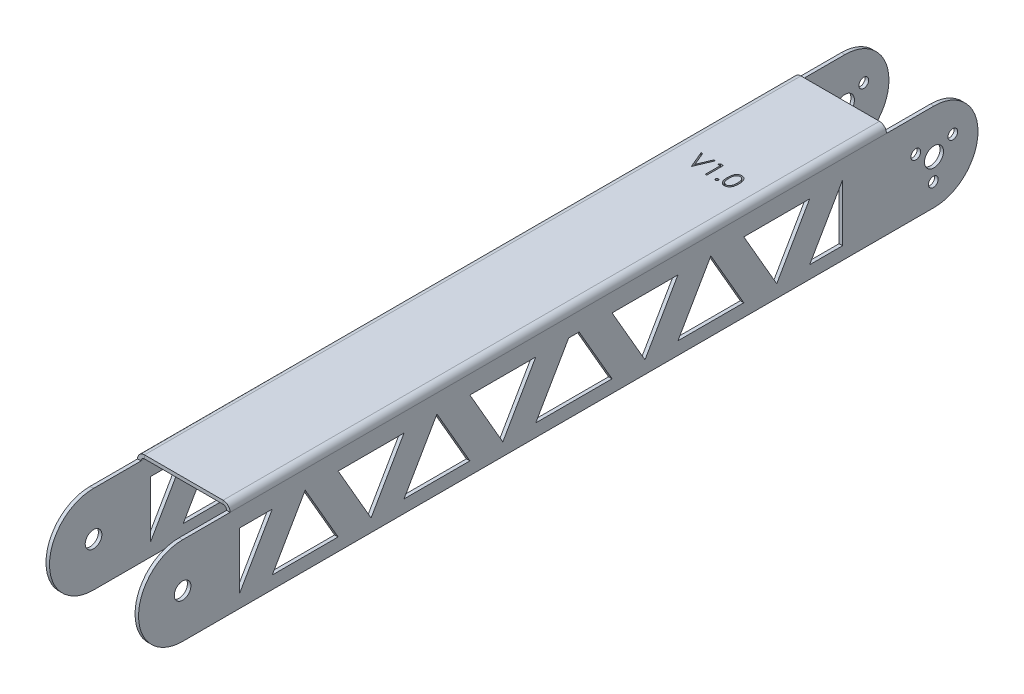
from build123d import *

# Parameters (mm, degrees)
SKETCH1_W                    = 16
SKETCH1_H                    = 138.1
BASE_FLANGE1_DEPTH           = 0.7366
EDGE_FLANGE1_DEPTH           = 138.1
EDGE_FLANGE1_BEND_DEPTH      = 138.1
SKETCH12_R                   = 2
TAB1_DEPTH                   = 0.7366
SKETCH15_R                   = 1.75
TAB2_DEPTH                   = 0.7366
F_2_05_2_05_DIAMETER_HOLE1_D = 2.05
CUT_EXTRUDE2_DEPTH           = 93.619987788
CUT_EXTRUDE3_DEPTH           = 10


# Sheet-metal steps are written as plain solids
with BuildPart() as part:
    # Sketch1 → Base-Flange1 (new body)
    with BuildSketch(Plane(origin=(0, 0, 0), x_dir=(1, 0, 0), z_dir=(0, 1, 0))):
        Rectangle(SKETCH1_W, SKETCH1_H)
    extrude(amount=-BASE_FLANGE1_DEPTH)

    # Edge-Flange1 section (across the edge) → Edge-Flange1 (add)
    with BuildSketch(Plane(origin=(9, -0.7366, -69.05), x_dir=(-1, 0, 0), z_dir=(0, 0, 1))):
        with BuildLine():
            Line((-0.7366, 0.7366), (-0.7366, 19.2634))
            Line((-0.7366, 19.2634), (0, 19.2634))
            Line((0, 19.2634), (0, 0.7366))
            ThreePointArc((0, 0.7366), (0.215745145, 0.215745145), (0.7366, 0))
            Line((0.7366, 0), (1, 0))
            Line((1, 0), (1, -0.7366))
            Line((1, -0.7366), (0.7366, -0.7366))
            ThreePointArc((0.7366, -0.7366), (-0.30510971, -0.30510971), (-0.7366, 0.7366))
        make_face()
    extrude(amount=EDGE_FLANGE1_DEPTH)

    # Edge-Flange1 section 2 (across the edge) → Edge-Flange1 bend (add)
    with BuildSketch(Plane(origin=(-9, -0.7366, 69.05), x_dir=(1, 0, 0), z_dir=(0, 0, -1))):
        with BuildLine():
            Line((-0.7366, 0.7366), (-0.7366, 19.2634))
            Line((-0.7366, 19.2634), (0, 19.2634))
            Line((0, 19.2634), (0, 0.7366))
            ThreePointArc((0, 0.7366), (0.215745145, 0.215745145), (0.7366, 0))
            Line((0.7366, 0), (1, 0))
            Line((1, 0), (1, -0.7366))
            Line((1, -0.7366), (0.7366, -0.7366))
            ThreePointArc((0.7366, -0.7366), (-0.30510971, -0.30510971), (-0.7366, 0.7366))
        make_face()
    extrude(amount=EDGE_FLANGE1_BEND_DEPTH)

    # Sketch12 → Tab1 (add)
    with BuildSketch(Plane.ZY.offset(9.7366)):
        with BuildLine():
            Line((-69.05, -1.4732), (-69.05, -20))
            Line((-69.05, -20), (-79.05, -20))
            ThreePointArc((-79.05, -20), (-88.3134, -10.7366), (-79.05, -1.4732))
            Line((-79.05, -1.4732), (-69.05, -1.4732))
        make_face()
        with Locations(Location((-79.05, -10.7366, 0), (0, 0, 270))):
            Circle(SKETCH12_R, mode=Mode.SUBTRACT)
    tab1 = extrude(amount=-TAB1_DEPTH)

    # Mirror1: Tab1 across plane
    add(tab1.mirror(Plane(origin=(0, 0, 0), x_dir=(0, 0, 1), z_dir=(1, 0, 0))))

    # Sketch15 → Tab2 (add)
    with BuildSketch(Plane(origin=(9.7366, 0, 0), x_dir=(0, 0, -1), z_dir=(1, 0, 0))):
        with BuildLine():
            Line((-69.05, -20), (-69.05, -1.4732))
            Line((-69.05, -1.4732), (-79.05, -1.4732))
            ThreePointArc((-79.05, -1.4732), (-88.3134, -10.7366), (-79.05, -20))
            Line((-79.05, -20), (-69.05, -20))
        make_face()
        with Locations(Location((-79.05, -10.7366, 0), (0, 0, 90))):
            Circle(SKETCH15_R, mode=Mode.SUBTRACT)
    tab2 = extrude(amount=-TAB2_DEPTH)

    # Mirror4: Tab2 across plane
    add(tab2.mirror(Plane(origin=(0, 0, 0), x_dir=(0, 0, 1), z_dir=(1, 0, 0))))

    # Ø2.05 (2.05) Diameter Hole1 (through all)
    with Locations(Plane(origin=(9.7366, -164.733279013, -147.010763523), x_dir=(-1.998433029121105e-15, 0.5501281243206819, -0.8350802637060755), z_dir=(1, 0, 0))):
        with Locations((32.447172363, 165.584185204), (25.375630841, 162.306487764), (26.072832352, 170.069471085)):
            Hole(F_2_05_2_05_DIAMETER_HOLE1_D / 2)

    # Sketch22 → Cut-Extrude2 (cut, through all)
    with BuildSketch(Plane.ZY.offset(9.7366)):
        Polygon((-52.894798022, -17.32077986), (-59.823001253, -5.32077986), (-59.823001253, -17.32077986), align=None)
        Polygon((-39.036594792, -5.32077986), (-52.893001253, -5.32077986), (-45.964798022, -17.32077986), align=None)
        Polygon((-32.103001253, -5.32077986), (-32.106594792, -5.32077986), (-39.034798022, -17.32077986), (-25.174798022, -17.32077986), align=None)
        Polygon((-11.316594792, -5.32077986), (-25.173001253, -5.32077986), (-18.244798022, -17.32077986), align=None)
        Polygon((-4.386594792, -5.32077986), (-11.314798022, -17.32077986), (4.740592287, -17.32077986), (-2.187610944, -5.32077986), align=None)
        Polygon((4.742389056, -5.32077986), (11.670592287, -17.32077986), (18.598795517, -5.32077986), align=None)
        Polygon((25.528795517, -5.32077986), (18.600592287, -17.32077986), (32.460592287, -17.32077986), (25.532389056, -5.32077986), align=None)
        Polygon((32.462389056, -5.32077986), (39.390592287, -17.32077986), (46.318795517, -5.32077986), align=None)
        Polygon((53.248795517, -5.32077986), (46.320592287, -17.32077986), (60.176998747, -17.32077986), align=None)
        Polygon((67.106998747, -5.32077986), (60.178795517, -5.32077986), (67.106998747, -17.32077986), align=None)
    extrude(amount=-CUT_EXTRUDE2_DEPTH, mode=Mode.SUBTRACT)

    # Sketch23 → Cut-Extrude3 (cut)
    # profile 1 of 4: a face of its own
    with BuildSketch(Plane(origin=(0, 0, 0), x_dir=(1, 0, 0), z_dir=(0, 1, 0))):
        Polygon((-4.796375708, 44.580068041), (-4.459837247, 44.580068041), (-3.29317058, 41.8218549), (-2.126503914, 44.580068041), (-1.789965452, 44.580068041), (-3.270734683, 41.080068041), (-3.315606478, 41.080068041), align=None)
    # profile 2 of 4: a face of its own
    with BuildSketch(Plane(origin=(0, 0, 0), x_dir=(1, 0, 0), z_dir=(0, 1, 0))):
        Polygon((-0.731972664, 44.580068041), (-0.084837247, 44.580068041), (-0.084837247, 41.080068041), (-0.398939811, 41.080068041), (-0.398939811, 44.221093682), (-0.937401349, 44.221093682), align=None)
    # profile 3 of 4: a face of its own
    with BuildSketch(Plane(origin=(0, 0, 0), x_dir=(1, 0, 0), z_dir=(0, 1, 0))):
        with BuildLine():
            add(Edge.make_bspline(
                [(1.77734224, 41.61852958), (1.796832452, 41.617371413), (1.835040735, 41.615100962), (1.890279863, 41.599524289), (1.940274523, 41.571865628), (1.984806768, 41.53500285), (2.021513244, 41.490307187), (2.050157596, 41.440711278), (2.065598581, 41.385009685), (2.067852493, 41.34658001), (2.069008907, 41.326862913)],
                knots=[0, 0, 0, 0, 1.020151414, 1.999887582, 2.974338812, 3.990962822, 5.007586832, 5.987933904, 6.967670073, 8, 8, 8, 8], degree=3))
            add(Edge.make_bspline(
                [(2.069008907, 41.326862913), (2.067813306, 41.307619583), (2.065455599, 41.269672019), (2.050192991, 41.214390557), (2.021294941, 41.164763652), (1.985059948, 41.119461514), (1.940263514, 41.082520644), (1.890161668, 41.055097299), (1.83517041, 41.038405319), (1.796854086, 41.036279022), (1.77734224, 41.035196246)],
                knots=[0, 0, 0, 0, 1.009421747, 1.99056486, 2.972319754, 3.999869655, 5.017953583, 5.993804169, 6.978383603, 8, 8, 8, 8], degree=3))
            add(Edge.make_bspline(
                [(1.77734224, 41.035196246), (1.757816335, 41.036239843), (1.719696652, 41.038277218), (1.664910658, 41.055440025), (1.614503689, 41.082263485), (1.569715977, 41.119530394), (1.533177506, 41.164530538), (1.505552123, 41.214732334), (1.488961974, 41.269513772), (1.486780101, 41.307588415), (1.485675574, 41.326862913)],
                knots=[0, 0, 0, 0, 1.022052826, 1.995314843, 2.982371812, 4.00089066, 5.028879526, 6.005146991, 6.990147033, 8, 8, 8, 8], degree=3))
            add(Edge.make_bspline(
                [(1.485675574, 41.326862913), (1.486737673, 41.346612293), (1.488811291, 41.385170533), (1.505586952, 41.44036964), (1.532963163, 41.490538079), (1.569968558, 41.534934659), (1.614492854, 41.572121962), (1.664789059, 41.599186755), (1.7198286, 41.615227167), (1.757838538, 41.617409684), (1.77734224, 41.61852958)],
                knots=[0, 0, 0, 0, 1.032775665, 2.016367738, 2.991239715, 4.008302682, 5.025365648, 6.011011707, 6.979408107, 8, 8, 8, 8], degree=3))
        make_face()
    # profile 4 of 4: a face of its own
    with BuildSketch(Plane(origin=(0, 0, 0), x_dir=(1, 0, 0), z_dir=(0, 1, 0))):
        with BuildLine():
            add(Edge.make_bspline(
                [(2.517726856, 42.828665797), (2.518054874, 42.884763185), (2.518692054, 42.993733169), (2.525780475, 43.152517812), (2.537555817, 43.301478101), (2.55369319, 43.440621167), (2.57333117, 43.569982931), (2.599546657, 43.689217688), (2.629359459, 43.798877295), (2.663911905, 43.899319343), (2.702899694, 43.991897046), (2.745333955, 44.078322248), (2.792898749, 44.15846418), (2.842875662, 44.23360197), (2.897287734, 44.302505665), (2.954586524, 44.366148328), (3.017008401, 44.423059078), (3.082431409, 44.474905381), (3.151447873, 44.520354852), (3.222090539, 44.560387591), (3.294845645, 44.594587458), (3.369911828, 44.621477894), (3.446614386, 44.643688741), (3.525221453, 44.658877688), (3.605862817, 44.668434597), (3.660294251, 44.669348265), (3.687899131, 44.669811631)],
                knots=[0, 0, 0, 0, 1.646270934, 3.197905019, 4.663502075, 6.030701355, 7.308322542, 8.50163776, 9.611534131, 10.641858119, 11.616356847, 12.558055219, 13.465016945, 14.349605745, 15.204443733, 16.039544428, 16.859896111, 17.680448484, 18.487036065, 19.28249412, 20.06191084, 20.843045899, 21.620316918, 22.403196591, 23.190181807, 24, 24, 24, 24], degree=3))
            add(Edge.make_bspline(
                [(3.687899131, 44.669811631), (3.71573461, 44.669323816), (3.771090619, 44.668353705), (3.852930994, 44.659029762), (3.932880676, 44.643558639), (4.010598814, 44.621637665), (4.086723801, 44.594441988), (4.160660208, 44.560354871), (4.23286729, 44.520676003), (4.302197578, 44.474052126), (4.369412193, 44.42206985), (4.432860156, 44.363307181), (4.492547242, 44.298357462), (4.549222547, 44.227915598), (4.601278144, 44.150630513), (4.650851577, 44.067846403), (4.695223613, 43.978115539), (4.737958288, 43.882935071), (4.774845274, 43.779671412), (4.80811152, 43.668906651), (4.834990488, 43.549332464), (4.857379761, 43.421576219), (4.874724657, 43.285168736), (4.887357299, 43.14040242), (4.894030384, 42.98718203), (4.895287085, 42.882424181), (4.895931984, 42.828665797)],
                knots=[0, 0, 0, 0, 0.810914788, 1.612654377, 2.396697861, 3.181598691, 3.963628158, 4.749916497, 5.551656086, 6.361998678, 7.18212741, 8.025565596, 8.878627764, 9.750805457, 10.657531673, 11.591944965, 12.560506719, 13.57287815, 14.630710178, 15.753379473, 16.941251878, 18.199788006, 19.531962791, 20.947069417, 22.433333509, 24, 24, 24, 24], degree=3))
            add(Edge.make_bspline(
                [(4.895931984, 42.828665797), (4.895280399, 42.77514189), (4.894010813, 42.670852738), (4.887432107, 42.518321762), (4.874473475, 42.374323719), (4.858263487, 42.238513257), (4.835812524, 42.111455638), (4.808207358, 41.992711189), (4.777557035, 41.881767118), (4.739722241, 41.779532306), (4.698311531, 41.684580583), (4.653256334, 41.595913435), (4.604986508, 41.512747142), (4.552397763, 41.435747395), (4.49634435, 41.364368738), (4.435626561, 41.299871116), (4.371955976, 41.240700444), (4.30454356, 41.188048816), (4.234132009, 41.141964011), (4.162172932, 41.100750161), (4.087389549, 41.067517466), (4.011476596, 41.038982425), (3.93334823, 41.017181973), (3.853101839, 41.002108118), (3.771145603, 40.991536269), (3.715744038, 40.990729789), (3.687899131, 40.990324451)],
                knots=[0, 0, 0, 0, 1.561518951, 3.042555995, 4.452378317, 5.7783523, 7.031515105, 8.214008947, 9.334062868, 10.386615937, 11.391082383, 12.354592575, 13.286541444, 14.194233754, 15.072674879, 15.931287219, 16.775624067, 17.606195743, 18.42308326, 19.229000347, 20.022332153, 20.807536673, 21.593273796, 22.3848459, 23.188221202, 24, 24, 24, 24], degree=3))
            add(Edge.make_bspline(
                [(3.687899131, 40.990324451), (3.660295017, 40.990790807), (3.605865093, 40.991710369), (3.525212667, 41.0012241), (3.446930224, 41.016519603), (3.37063147, 41.037936208), (3.295924955, 41.064151044), (3.223828668, 41.098304727), (3.153540984, 41.137638796), (3.085249428, 41.182434218), (3.020237267, 41.233755901), (2.958138662, 41.29052019), (2.900513643, 41.354143601), (2.846879547, 41.423621524), (2.795905459, 41.498314766), (2.749016086, 41.579243139), (2.705645232, 41.66608575), (2.666001741, 41.759403661), (2.630853077, 41.860558588), (2.599805369, 41.970707767), (2.575291212, 42.090823403), (2.554308256, 42.21994077), (2.537383873, 42.358614701), (2.525829548, 42.506920479), (2.518688233, 42.664765688), (2.518053163, 42.773035462), (2.517726856, 42.828665797)],
                knots=[0, 0, 0, 0, 0.810891512, 1.598919785, 2.382837074, 3.152667961, 3.926044502, 4.706494248, 5.493654104, 6.291793342, 7.103789334, 7.925228297, 8.761435821, 9.622817696, 10.50288917, 11.416980706, 12.369136599, 13.353924996, 14.394355917, 15.514179734, 16.714354668, 17.994756427, 19.357759367, 20.818452758, 22.365282078, 24, 24, 24, 24], degree=3))
        make_face()
        with BuildLine():
            add(Edge.make_bspline(
                [(2.83182942, 42.830068041), (2.831948867, 42.783319342), (2.83218069, 42.692589297), (2.838236891, 42.560746037), (2.846487123, 42.437775708), (2.85712842, 42.323522171), (2.872931368, 42.218372159), (2.890638156, 42.121602476), (2.912186246, 42.033725239), (2.937681264, 41.954137428), (2.966720361, 41.881488359), (2.998426224, 41.813887144), (3.032486947, 41.750535208), (3.070606098, 41.692001599), (3.112121161, 41.638095435), (3.15609442, 41.587862603), (3.204167004, 41.543065622), (3.270670747, 41.489338767), (3.358467221, 41.433819633), (3.469087677, 41.385473543), (3.582756128, 41.355091087), (3.659907378, 41.351227331), (3.698415958, 41.34929881)],
                knots=[0, 0, 0, 0, 1.459021318, 2.831673884, 4.118529203, 5.306027144, 6.411944654, 7.436330062, 8.375795394, 9.233974572, 10.042671642, 10.816086306, 11.563610507, 12.285937304, 12.993564865, 13.685989202, 14.367179055, 15.041617293, 16.353048772, 17.594441528, 18.799311195, 20, 20, 20, 20], degree=3))
            add(Edge.make_bspline(
                [(3.698415958, 41.34929881), (3.73717363, 41.350896591), (3.814608953, 41.354088854), (3.927742748, 41.384887591), (4.037573018, 41.431357131), (4.123644959, 41.486304636), (4.189127502, 41.538632966), (4.236044492, 41.583247614), (4.279106541, 41.633203481), (4.319948615, 41.687102777), (4.357407691, 41.745975261), (4.391470829, 41.809537837), (4.422554176, 41.877967015), (4.440263222, 41.925736754), (4.449317401, 41.950160189)],
                knots=[0, 0, 0, 0, 1.353760809, 2.704726607, 4.075137775, 5.516104923, 6.260822281, 7.007110065, 7.778089737, 8.566572457, 9.372053459, 10.217411131, 11.088608312, 12, 12, 12, 12], degree=3))
            add(Edge.make_bspline(
                [(4.449317401, 41.950160189), (4.459869168, 41.981389928), (4.481293782, 42.044799692), (4.508905556, 42.143163344), (4.530650956, 42.246366108), (4.550214321, 42.353791225), (4.563567377, 42.466230926), (4.574315191, 42.58333731), (4.580645877, 42.705198672), (4.581430629, 42.787993663), (4.58182942, 42.830068041)],
                knots=[0, 0, 0, 0, 0.884706709, 1.796334032, 2.740027952, 3.714592787, 4.726048262, 5.777819803, 6.87074269, 8, 8, 8, 8], degree=3))
            add(Edge.make_bspline(
                [(4.58182942, 42.830068041), (4.58127923, 42.872135614), (4.580202943, 42.954428778), (4.576088955, 43.074946959), (4.565465381, 43.18941472), (4.553666262, 43.298325193), (4.536269041, 43.401075495), (4.517511234, 43.498525801), (4.492310021, 43.589468825), (4.465390246, 43.675328407), (4.434579851, 43.755129062), (4.400664117, 43.829242848), (4.364442358, 43.898027573), (4.325100117, 43.961294514), (4.283104434, 44.019327057), (4.237346885, 44.070961652), (4.189642512, 44.11779862), (4.122825327, 44.171261189), (4.035351037, 44.225772884), (3.926505389, 44.275938644), (3.813234745, 44.304746937), (3.736661291, 44.308808624), (3.698415958, 44.310837272)],
                knots=[0, 0, 0, 0, 1.31362396, 2.569729283, 3.763502607, 4.902122613, 5.988968491, 7.01645872, 7.998833611, 8.933434873, 9.825090667, 10.667526885, 11.477055099, 12.250526234, 12.991942729, 13.710640831, 14.402115721, 15.076753259, 16.378508321, 17.609869233, 18.806226677, 20, 20, 20, 20], degree=3))
            add(Edge.make_bspline(
                [(3.698415958, 44.310837272), (3.659705366, 44.308805825), (3.582213661, 44.304739231), (3.467765706, 44.276045978), (3.358061354, 44.226033012), (3.270818379, 44.171080639), (3.203954593, 44.118742328), (3.1568719, 44.073355874), (3.112725727, 44.023709619), (3.072058027, 43.969307704), (3.033968744, 43.910842337), (2.998987731, 43.847853572), (2.967470402, 43.780022208), (2.938385866, 43.707405773), (2.912813078, 43.627824828), (2.891719114, 43.540055835), (2.872232061, 43.443593943), (2.858436792, 43.337874435), (2.846173037, 43.223592282), (2.838291689, 43.100314963), (2.832160431, 42.968250583), (2.831941967, 42.877051424), (2.83182942, 42.830068041)],
                knots=[0, 0, 0, 0, 1.207732386, 2.417664972, 3.655092373, 4.956220595, 5.625982001, 6.301752483, 6.994047911, 7.697131622, 8.419323945, 9.170223765, 9.943494443, 10.752040957, 11.610060368, 12.549350801, 13.567764191, 14.679664412, 15.874934091, 17.154273443, 18.533957287, 20, 20, 20, 20], degree=3))
        make_face(mode=Mode.SUBTRACT)
    extrude(amount=-CUT_EXTRUDE3_DEPTH, mode=Mode.SUBTRACT)


with BuildPart() as cut_extrude3_piece_1:
    # of the separate pieces the step leaves, piece 1, a body of its own (cut_extrude3_pieces)
    add(part.part.solids().sort_by_distance((8.2634, -0.7366, -69.05))[0])


with BuildPart() as cut_extrude3_piece_2:
    # of the separate pieces the step leaves, piece 2, a body of its own (cut_extrude3_pieces)
    add(part.part.solids().sort_by_distance((4.449317401, -0.7366, -41.950160189))[0])


solid = Compound([cut_extrude3_piece_1.part, cut_extrude3_piece_2.part])
